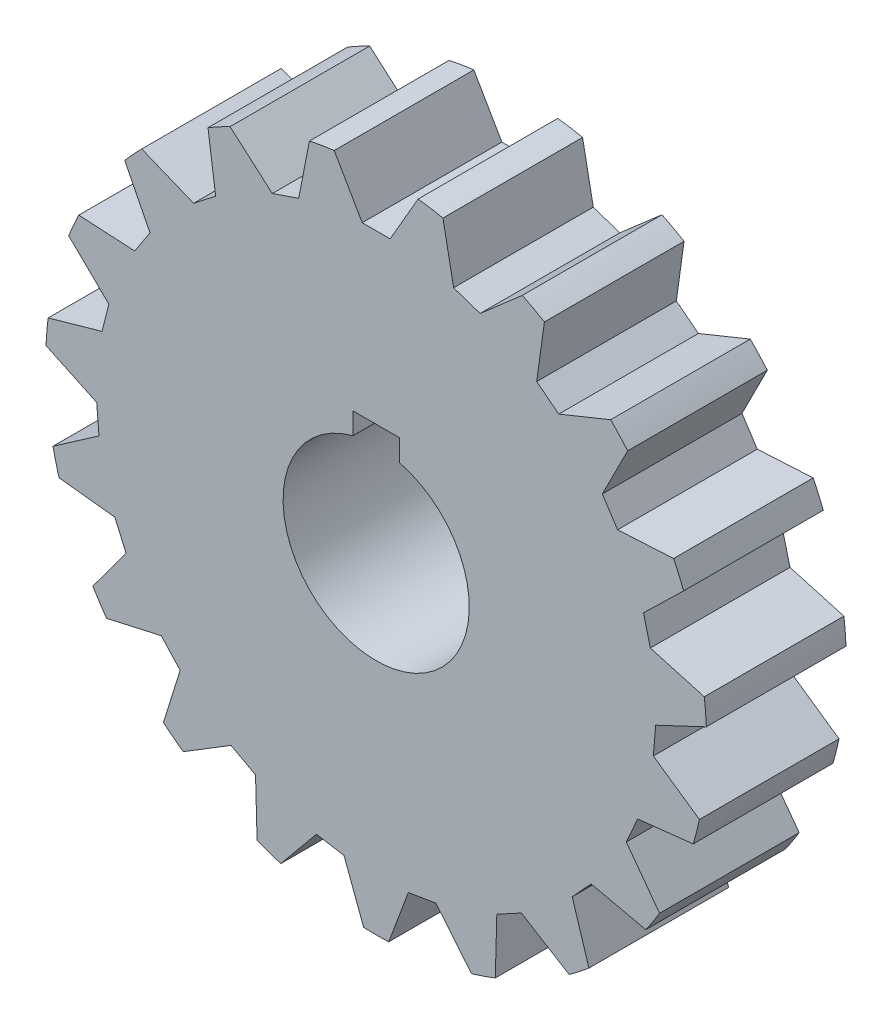
from build123d import *

# Parameters (mm, degrees)
SKETCH1_R           = 35.5
BOSS_EXTRUDE1_DEPTH = 7.5
SKETCH4_OUTSIDE_W   = 93.304
SKETCH4_OUTSIDE_H   = 93.304
CUT_EXTRUDE2_DEPTH  = 53.397519025


with BuildPart() as part:
    # Sketch1 → Boss-Extrude1 (new, symmetric)
    with BuildSketch(Plane.XY):
        Circle(SKETCH1_R)
        with BuildLine():
            Line((-2.5, 12), (2.5, 12))
            Line((2.5, 12), (2.5, 9.682458366))
            ThreePointArc((2.5, 9.682458366), (0, -10), (-2.5, 9.682458366))
            Line((-2.5, 9.682458366), (-2.5, 12))
        make_face(mode=Mode.SUBTRACT)
    extrude(amount=BOSS_EXTRUDE1_DEPTH, both=True)

    # Sketch4 outside → Cut-Extrude2 (cut, through all)
    with BuildSketch(Plane.XY.offset(7.5)):
        Rectangle(SKETCH4_OUTSIDE_W, SKETCH4_OUTSIDE_H)
        with BuildLine():
            Line((1.5, 30), (-1.5, 30))
            Line((-1.5, 30), (-4.509398661, 35.21243138))
            ThreePointArc((-4.509398661, 35.21243138), (-5.843107955, 35.015826271), (-7.168390776, 34.768724073))
            Line((-7.168390776, 34.768724073), (-8.322258214, 28.861566455))
            Line((-8.322258214, 28.861566455), (-11.159709939, 27.887468047))
            Line((-11.159709939, 27.887468047), (-15.698524782, 31.84032537))
            ThreePointArc((-15.698524782, 31.84032537), (-16.896132453, 31.221318168), (-18.069373842, 30.557286021))
            Line((-18.069373842, 30.557286021), (-17.242670617, 24.595534351))
            Line((-17.242670617, 24.595534351), (-19.610092145, 22.752896213))
            Line((-19.610092145, 22.752896213), (-25.186472155, 25.017826053))
            ThreePointArc((-25.186472155, 25.017826053), (-26.118198829, 24.043495793), (-27.012259878, 23.034491882))
            Line((-27.012259878, 23.034491882), (-24.294572111, 17.664194461))
            Line((-24.294572111, 17.664194461), (-25.935416585, 15.152695026))
            Line((-25.935416585, 15.152695026), (-31.945074461, 15.484257091))
            ThreePointArc((-31.945074461, 15.484257091), (-32.509953096, 14.260187575), (-33.027948418, 13.015553132))
            Line((-33.027948418, 13.015553132), (-28.713779747, 8.818665013))
            Line((-28.713779747, 8.818665013), (-29.450236209, 5.910464215))
            Line((-29.450236209, 5.910464215), (-35.241932271, 4.27272861))
            ThreePointArc((-35.241932271, 4.27272861), (-35.378749502, 2.931566764), (-35.464546265, 1.586177242))
            Line((-35.464546265, 1.586177242), (-30.021403808, -0.982503625))
            Line((-30.021403808, -0.982503625), (-29.773665772, -3.972257104))
            Line((-29.773665772, -3.972257104), (-34.719779885, -7.401816314))
            ThreePointArc((-34.719779885, -7.401816314), (-34.413709441, -8.714734794), (-34.058010235, -10.015085564))
            Line((-34.058010235, -10.015085564), (-28.075742937, -10.67720275))
            Line((-28.075742937, -10.67720275), (-26.870656663, -13.42452273))
            Line((-26.870656663, -13.42452273), (-30.435200615, -18.274259589))
            ThreePointArc((-30.435200615, -18.274259589), (-29.719409978, -19.416659613), (-28.960760331, -20.531058449))
            Line((-28.960760331, -20.531058449), (-23.087639678, -19.214861283))
            Line((-23.087639678, -19.214861283), (-21.055794963, -21.422033015))
            Line((-21.055794963, -21.422033015), (-22.852495108, -27.166403283))
            ThreePointArc((-22.852495108, -27.166403283), (-21.8045513, -28.014488084), (-20.725162674, -28.822172579))
            Line((-20.725162674, -28.822172579), (-15.597632418, -25.670291447))
            Line((-15.597632418, -25.670291447), (-12.959211164, -27.098133626))
            Line((-12.959211164, -27.098133626), (-12.793367162, -33.114645652))
            ThreePointArc((-12.793367162, -33.114645652), (-11.526831157, -33.57651208), (-10.243672056, -33.989957087))
            Line((-10.243672056, -33.989957087), (-6.417379664, -29.343947217))
            Line((-6.417379664, -29.343947217), (-3.458295753, -29.837730988))
            Line((-3.458295753, -29.837730988), (-1.347879375, -35.474402337))
            ThreePointArc((-1.347879375, -35.474402337), (0, -35.5), (1.347879375, -35.474402337))
            Line((1.347879375, -35.474402337), (3.458295753, -29.837730988))
            Line((3.458295753, -29.837730988), (6.417379664, -29.343947217))
            Line((6.417379664, -29.343947217), (10.243672056, -33.989957087))
            ThreePointArc((10.243672056, -33.989957087), (11.526831157, -33.57651208), (12.793367162, -33.114645652))
            Line((12.793367162, -33.114645652), (12.959211164, -27.098133626))
            Line((12.959211164, -27.098133626), (15.597632418, -25.670291447))
            Line((15.597632418, -25.670291447), (20.725162674, -28.822172579))
            ThreePointArc((20.725162674, -28.822172579), (21.8045513, -28.014488084), (22.852495108, -27.166403283))
            Line((22.852495108, -27.166403283), (21.055794963, -21.422033015))
            Line((21.055794963, -21.422033015), (23.087639678, -19.214861283))
            Line((23.087639678, -19.214861283), (28.960760331, -20.531058449))
            ThreePointArc((28.960760331, -20.531058449), (29.719409978, -19.416659613), (30.435200615, -18.274259589))
            Line((30.435200615, -18.274259589), (26.870656663, -13.42452273))
            Line((26.870656663, -13.42452273), (28.075742937, -10.67720275))
            Line((28.075742937, -10.67720275), (34.058010235, -10.015085564))
            ThreePointArc((34.058010235, -10.015085564), (34.413709441, -8.714734793), (34.719779885, -7.401816314))
            Line((34.719779885, -7.401816314), (29.773665772, -3.972257104))
            Line((29.773665772, -3.972257104), (30.021403808, -0.982503625))
            Line((30.021403808, -0.982503625), (35.464546265, 1.586177242))
            ThreePointArc((35.464546265, 1.586177242), (35.378749502, 2.931566764), (35.241932271, 4.27272861))
            Line((35.241932271, 4.27272861), (29.450236209, 5.910464215))
            Line((29.450236209, 5.910464215), (28.713779747, 8.818665013))
            Line((28.713779747, 8.818665013), (33.027948418, 13.015553132))
            ThreePointArc((33.027948418, 13.015553132), (32.509953096, 14.260187575), (31.945074461, 15.484257091))
            Line((31.945074461, 15.484257091), (25.935416585, 15.152695026))
            Line((25.935416585, 15.152695026), (24.294572111, 17.664194461))
            Line((24.294572111, 17.664194461), (27.012259878, 23.034491882))
            ThreePointArc((27.012259878, 23.034491882), (26.118198829, 24.043495793), (25.186472155, 25.017826053))
            Line((25.186472155, 25.017826053), (19.610092145, 22.752896213))
            Line((19.610092145, 22.752896213), (17.242670617, 24.595534351))
            Line((17.242670617, 24.595534351), (18.069373842, 30.557286021))
            ThreePointArc((18.069373842, 30.557286021), (16.896132453, 31.221318168), (15.698524782, 31.84032537))
            Line((15.698524782, 31.84032537), (11.159709939, 27.887468047))
            Line((11.159709939, 27.887468047), (8.322258214, 28.861566455))
            Line((8.322258214, 28.861566455), (7.168390776, 34.768724073))
            ThreePointArc((7.168390776, 34.768724073), (5.843107955, 35.015826271), (4.509398661, 35.21243138))
            Line((4.509398661, 35.21243138), (1.5, 30))
        make_face(mode=Mode.SUBTRACT)
    extrude(amount=-CUT_EXTRUDE2_DEPTH, mode=Mode.SUBTRACT)


solid = part.part
